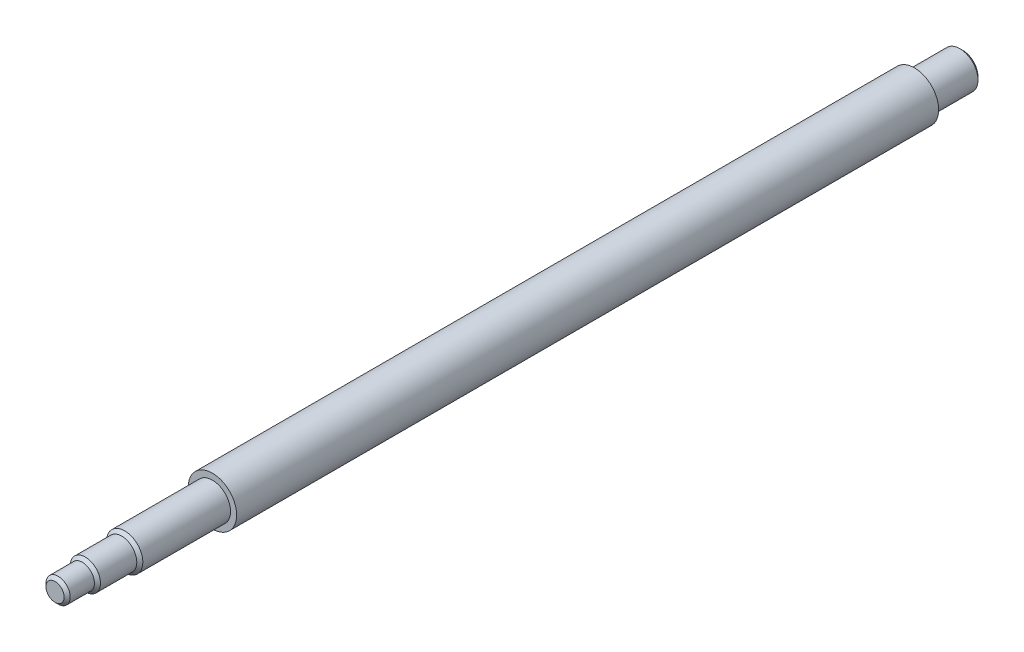
from build123d import *

# Parameters (mm, degrees)
SFAZOWANIE1_SIZE = 1
SFAZOWANIE2_SIZE = 1


with BuildPart() as part:
    # Szkic1 → Obrót1 (revolve)
    with BuildSketch(Plane(origin=(0, 0, 0), x_dir=(0, 0, -1), z_dir=(1, 0, 0)), mode=Mode.PRIVATE) as obr_t1_sk:
        Polygon((0, 0), (300, 0), (300, 6), (284, 6), (284, 8), (52, 8), (52, 6), (22, 6), (22, 5), (9, 5), (9, 4), (0, 4), align=None)
    revolve(obr_t1_sk.sketch.rotate(Axis((0, 0, 0), (0, 0, -1)), 90), axis=Axis((0, 0, 0), (0, 0, -1)))

    # Sfazowanie1
    sfazowanie1_edges = [part.edges().sort_by_distance(p)[0] for p in [
        (-6, 0, -22),
        (-4, 0, 0),
        (-5, 0, -9),
    ]]
    chamfer(sfazowanie1_edges, length=SFAZOWANIE1_SIZE - 0.0001)  # a hair under: the kernel refuses the full size

    # Sfazowanie2
    sfazowanie2_edges = [part.edges().sort_by_distance(p)[0] for p in [
        (-6, 0, -300),
    ]]
    chamfer(sfazowanie2_edges, length=SFAZOWANIE2_SIZE)


solid = part.part
